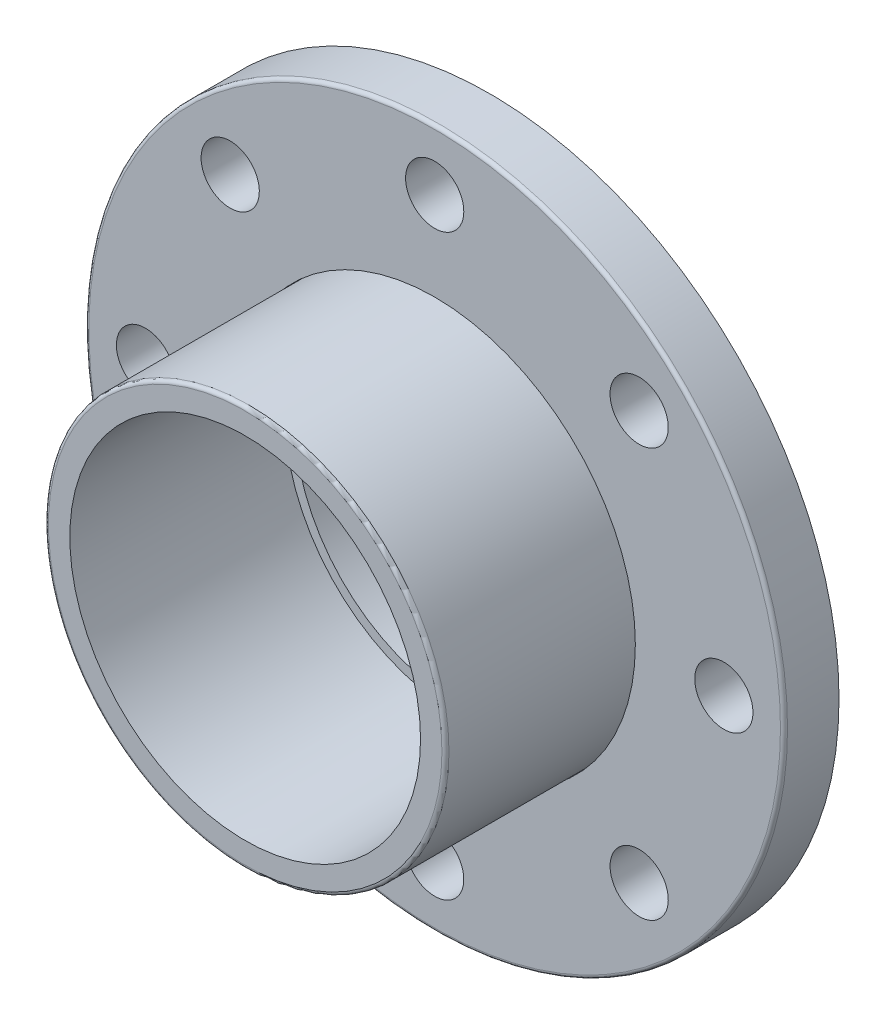
from build123d import *

# Parameters (mm, degrees)
SKETCH1_R                       = 114.3
EXTRUDE1_DEPTH                  = 18
SKETCH2_R                       = 65.532
EXTRUDE2_DEPTH                  = 62
SKETCH3_R                       = 9.525
EXTRUDE3_DEPTH                  = 174.127063165
CIRPATTERN1_COUNT               = 8
FILLET1_R                       = 1.154545455
CUT_REVOLVE_THIN1_START         = 8.422727273
CUT_REVOLVE_THIN1_OUTLINE_R     = 75.057
CUT_REVOLVE_THIN1_OUTLINE_R_2   = 65.532
CUT_REVOLVE_THIN1_DEPTH         = 0.127
CUT_REVOLVE_THIN1_2_OUTLINE_R   = 75.057
CUT_REVOLVE_THIN1_2_OUTLINE_R_2 = 74.93
CUT_REVOLVE_THIN1_2_DEPTH       = 8.422727273
CUT_REVOLVE_THIN1_START_2       = 8.549727273
CUT_REVOLVE_THIN1_3_OUTLINE_R   = 65.659
CUT_REVOLVE_THIN1_3_OUTLINE_R_2 = 65.532
CUT_REVOLVE_THIN1_3_DEPTH       = 9.450272727


# Read off the part's stored shape, not the designer's step: Cut-Revolve-Thin1
with BuildPart() as part:
    # Sketch1 → Extrude1 (new body)
    with BuildSketch(Plane.XY):
        Circle(SKETCH1_R)
    extrude(amount=EXTRUDE1_DEPTH)

    # Sketch2 → Extrude2 (add)
    with BuildSketch(Plane.XY.offset(18)):
        Circle(SKETCH2_R)
    extrude(amount=EXTRUDE2_DEPTH)

    # Sketch3 → Extrude3 (cut, through all)
    with BuildSketch(Plane.XY.offset(18)):
        with Locations((0, 94.615)):
            Circle(SKETCH3_R)
    extrude3 = extrude(amount=-EXTRUDE3_DEPTH, mode=Mode.SUBTRACT)

    # CirPattern1: Extrude3 ×8 about axis
    cirpattern1_axis = Axis((0, 0, 0), (0, 0, 1))
    for i in range(1, CIRPATTERN1_COUNT):
        add(extrude3.rotate(cirpattern1_axis, i * 360 / CIRPATTERN1_COUNT), mode=Mode.SUBTRACT)

    # Fillet1
    fillet1_edges = [part.edges().sort_by_distance(p)[0] for p in [
        (-114.3, 0, 18),
        (-65.532, 0, 80),
    ]]
    fillet(fillet1_edges, radius=FILLET1_R)

    # Sketch4 → Cut-Revolve1 (revolve, cut)
    with BuildSketch(Plane(origin=(0, 0, 62.70625), x_dir=(0, 0, 1), z_dir=(-1, 0, 0)), mode=Mode.PRIVATE) as cut_revolve1_sk:
        Polygon((-62.70625, 53.848), (-52.70625, 53.848), (-52.70625, 57.0357), (17.29375, 57.3786), (17.29375, 0), (-62.70625, 0), align=None)
    revolve(cut_revolve1_sk.sketch.rotate(Axis((0, 0, 80), (0, 0, -1)), 90), axis=Axis((0, 0, 80), (0, 0, -1)), mode=Mode.SUBTRACT)

    # Cut-Revolve-Thin1 outline → Cut-Revolve-Thin1 (cut)
    with BuildSketch(Plane.XY.offset(CUT_REVOLVE_THIN1_START)):
        Circle(CUT_REVOLVE_THIN1_OUTLINE_R)
        Circle(CUT_REVOLVE_THIN1_OUTLINE_R_2, mode=Mode.SUBTRACT)
    extrude(amount=CUT_REVOLVE_THIN1_DEPTH, mode=Mode.SUBTRACT)

    # Cut-Revolve-Thin1 2 outline → Cut-Revolve-Thin1 2 (cut)
    with BuildSketch(Plane.XY):
        Circle(CUT_REVOLVE_THIN1_2_OUTLINE_R)
        Circle(CUT_REVOLVE_THIN1_2_OUTLINE_R_2, mode=Mode.SUBTRACT)
    extrude(amount=CUT_REVOLVE_THIN1_2_DEPTH, mode=Mode.SUBTRACT)

    # Cut-Revolve-Thin1 3 outline → Cut-Revolve-Thin1 3 (cut)
    with BuildSketch(Plane.XY.offset(CUT_REVOLVE_THIN1_START_2)):
        Circle(CUT_REVOLVE_THIN1_3_OUTLINE_R)
        Circle(CUT_REVOLVE_THIN1_3_OUTLINE_R_2, mode=Mode.SUBTRACT)
    extrude(amount=CUT_REVOLVE_THIN1_3_DEPTH, mode=Mode.SUBTRACT)


solid = part.part
